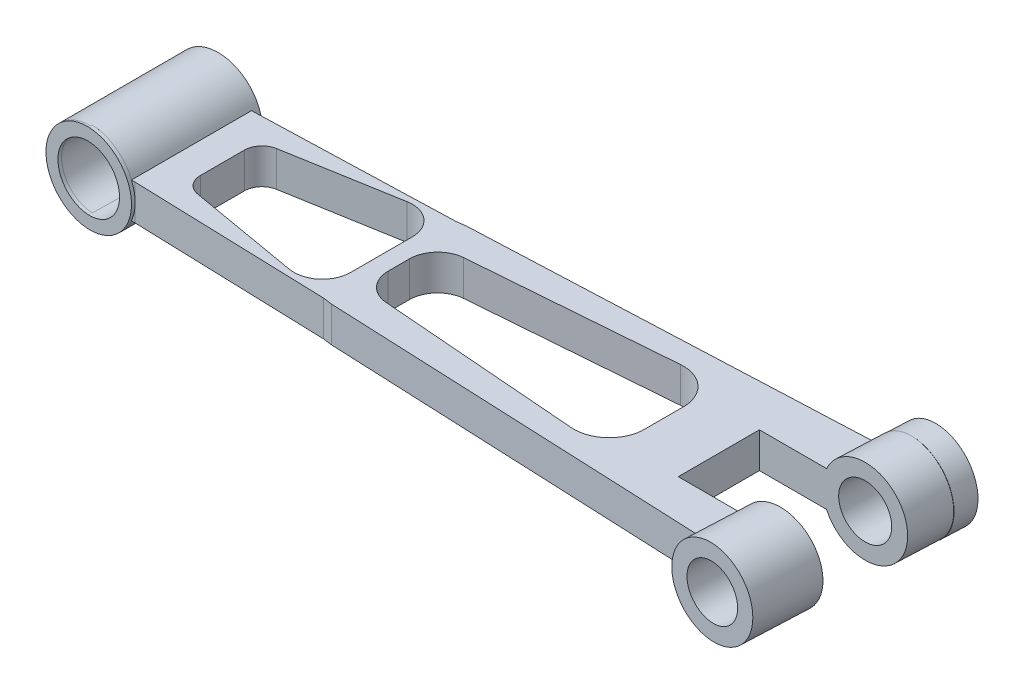
from build123d import *

# Parameters (mm, degrees)
BOSS_EXTRUDE6_DEPTH  = 10
BOSS_EXTRUDE7_DEPTH  = 10
BOSS_EXTRUDE9_DEPTH  = 10
SKETCH19_R           = 12.5
BOSS_EXTRUDE10_DEPTH = 35
SKETCH20_W           = 1.043560763
SKETCH20_H           = 10
CUT_EXTRUDE3_DEPTH   = 210.469322495
SKETCH21_R           = 12.5
BOSS_EXTRUDE11_DEPTH = 36
SKETCH22_R           = 9
CUT_EXTRUDE4_DEPTH   = 210.469322495
SKETCH23_R           = 12
BOSS_EXTRUDE12_DEPTH = 48
SKETCH24_R           = 12.5
BOSS_EXTRUDE13_DEPTH = 1
SKETCH25_R           = 9.000008948
CUT_EXTRUDE5_DEPTH   = 222.635791619
BOSS_EXTRUDE14_START = 6.5
SKETCH26_R           = 12
BOSS_EXTRUDE14_DEPTH = 6.5
SKETCH27_R           = 12
BOSS_EXTRUDE15_DEPTH = 6.5
SKETCH29_R           = 7.5
CUT_EXTRUDE6_DEPTH   = 225.72641495
CUT_EXTRUDE8_DEPTH   = 35


with BuildPart() as part:
    # Sketch16 → Boss-Extrude6 (new body)
    with BuildSketch(Plane(origin=(0, 0, 0), x_dir=(1, 0, 0), z_dir=(0, 1, 0))):
        Polygon((0, 17), (0, -17), (25, -17), (80.109212305, -18.756428184), (80.109212305, 18.756428184), (25, 17), align=None)
        with BuildLine():
            Line((77.609212305, 8.794026491), (77.609212305, -8.65404217))
            ThreePointArc((77.609212305, -8.65404217), (74.760839475, -14.774559918), (68.24402793, -16.536698551))
            Line((68.24402793, -16.536698551), (36.75597207, -11.083333621))
            ThreePointArc((36.75597207, -11.083333621), (33.783888713, -9.376440364), (32.609212305, -6.156673383))
            Line((32.609212305, -6.156673383), (32.609212305, 6.296657704))
            ThreePointArc((32.609212305, 6.296657704), (33.783888713, 9.516424685), (36.75597207, 11.223317942))
            Line((36.75597207, 11.223317942), (68.24402793, 16.676682872))
            ThreePointArc((68.24402793, 16.676682872), (74.760839475, 14.914544239), (77.609212305, 8.794026491))
        make_face(mode=Mode.SUBTRACT)
    extrude(amount=BOSS_EXTRUDE6_DEPTH)

    # Sketch17 → Boss-Extrude7 (add)
    with BuildSketch(Plane(origin=(0, 10, 0), x_dir=(1, 0, 0), z_dir=(0, 1, 0))):
        Polygon((82.586727687, 19.090968963), (80.109212305, 18.756428184), (80.109212305, -18.756428184), (82.586727687, -19.090968963), (162.586727687, -22.583844395), (162.586727687, 22.583844395), align=None)
        with BuildLine():
            Line((157.586727687, 5), (157.586727687, -5))
            ThreePointArc((157.586727687, -5), (154.560888112, -12.658620458), (146.813698133, -15.449896132))
            Line((146.813698133, -15.449896132), (89.959054921, -10.97533867))
            ThreePointArc((89.959054921, -10.97533867), (84.712147611, -8.430405964), (82.586727687, -3))
            Line((82.586727687, -3), (82.586727687, 3))
            ThreePointArc((82.586727687, 3), (84.712147611, 8.430405964), (89.959054921, 10.97533867))
            Line((89.959054921, 10.97533867), (146.813698133, 15.449896132))
            ThreePointArc((146.813698133, 15.449896132), (154.560888112, 12.658620458), (157.586727687, 5))
        make_face(mode=Mode.SUBTRACT)
    extrude(amount=-BOSS_EXTRUDE7_DEPTH)

    # Sketch18 → Boss-Extrude9 (add)
    with BuildSketch(Plane(origin=(0, 10, 0), x_dir=(1, 0, 0), z_dir=(0, 1, 0))):
        Polygon((162.586727687, 22.583844395), (204.586727687, 24.417603998), (204.586727687, -24.417603998), (162.586727687, -22.583844395), align=None)
    extrude(amount=-BOSS_EXTRUDE9_DEPTH)

    # Sketch19 → Boss-Extrude10 (add)
    with BuildSketch(Plane.XY.offset(17)):
        with Locations((12.5, 5)):
            Circle(SKETCH19_R)
    extrude(amount=-BOSS_EXTRUDE10_DEPTH)

    # Sketch20 → Cut-Extrude3 (cut, through all)
    with BuildSketch(Plane.XY.offset(17)):
        with Locations((0.521780382, 5)):
            Rectangle(SKETCH20_W, SKETCH20_H)
    extrude(amount=-CUT_EXTRUDE3_DEPTH, mode=Mode.SUBTRACT)

    # Sketch21 → Boss-Extrude11 (add)
    with BuildSketch(Plane.XY.offset(17)):
        with Locations((12.5, 5)):
            Circle(SKETCH21_R)
    extrude(amount=-BOSS_EXTRUDE11_DEPTH)

    # Sketch22 → Cut-Extrude4 (cut, through all)
    with BuildSketch(Plane.XY.offset(17)):
        with Locations((12.5, 5)):
            Circle(SKETCH22_R)
    extrude(amount=-CUT_EXTRUDE4_DEPTH, mode=Mode.SUBTRACT)

    # Sketch23 → Boss-Extrude12 (add)
    with BuildSketch(Plane(origin=(-0.674810074, 0, 15.455691716), x_dir=(0.9990482215818578, 0, 0.04361938736533612), z_dir=(-0.04361938736533611, 0, 0.9990482215818577))):
        with Locations((203.229632355, 5)):
            Circle(SKETCH23_R)
    extrude(amount=-BOSS_EXTRUDE12_DEPTH)

    # Sketch24 → Boss-Extrude13 (add)
    with BuildSketch(Plane(origin=(-0.515900802, 0, 16.186763058), x_dir=(0.9994924817365809, 0, 0.03185559530208948), z_dir=(-0.03185559530208948, 0, 0.9994924817365809))):
        with Locations((13.035201142, 5)):
            Circle(SKETCH24_R)
    extrude(amount=BOSS_EXTRUDE13_DEPTH)

    # Sketch25 → Cut-Extrude5 (cut, through all)
    with BuildSketch(Plane(origin=(-0.547756398, 0, 17.186255539), x_dir=(0.9994924817365809, 0, 0.03185559530208948), z_dir=(-0.03185559530208948, 0, 0.9994924817365809))):
        with Locations((13.035201142, 5)):
            Circle(SKETCH25_R)
    extrude(amount=-CUT_EXTRUDE5_DEPTH, mode=Mode.SUBTRACT)

    # Sketch26 → Boss-Extrude14 (add)
    with BuildSketch(Plane(origin=(-0.674810074, 0, 15.455691716), x_dir=(0.9990482215818578, 0, 0.04361938736533612), z_dir=(-0.04361938736533611, 0, 0.9990482215818577)).offset(BOSS_EXTRUDE14_START)):
        with Locations((203.229632355, 5)):
            Circle(SKETCH26_R)
    extrude(amount=-BOSS_EXTRUDE14_DEPTH)

    # Sketch27 → Boss-Extrude15 (add)
    with BuildSketch(Plane(origin=(1.41892052, 0, -32.49862292), x_dir=(-0.9990482215818578, 0, -0.04361938736533613), z_dir=(0.043619387365336125, 0, -0.9990482215818577))):
        with Locations((-203.326925527, 5)):
            Circle(SKETCH27_R)
    extrude(amount=BOSS_EXTRUDE15_DEPTH)

    # Sketch29 → Cut-Extrude6 (cut, through all)
    with BuildSketch(Plane(origin=(-0.958336092, 0, 21.949505156), x_dir=(0.9990482215818578, 0, 0.04361938736533613), z_dir=(-0.043619387365336125, 0, 0.9990482215818577))):
        with Locations((203.229632355, 5)):
            Circle(SKETCH29_R)
    extrude(amount=-CUT_EXTRUDE6_DEPTH, mode=Mode.SUBTRACT)

    # Sketch30 → Cut-Extrude8 (cut, symmetric)
    with BuildSketch(Plane(origin=(0, 10, 0), x_dir=(1, 0, 0), z_dir=(0, 1, 0))):
        Polygon((215.96538569, 10.619437579), (173.96538569, 10.619437579), (173.96538569, -12.337689863), (215.170754227, -12.337689863), align=None)
    extrude(amount=CUT_EXTRUDE8_DEPTH, both=True, mode=Mode.SUBTRACT)


solid = part.part
